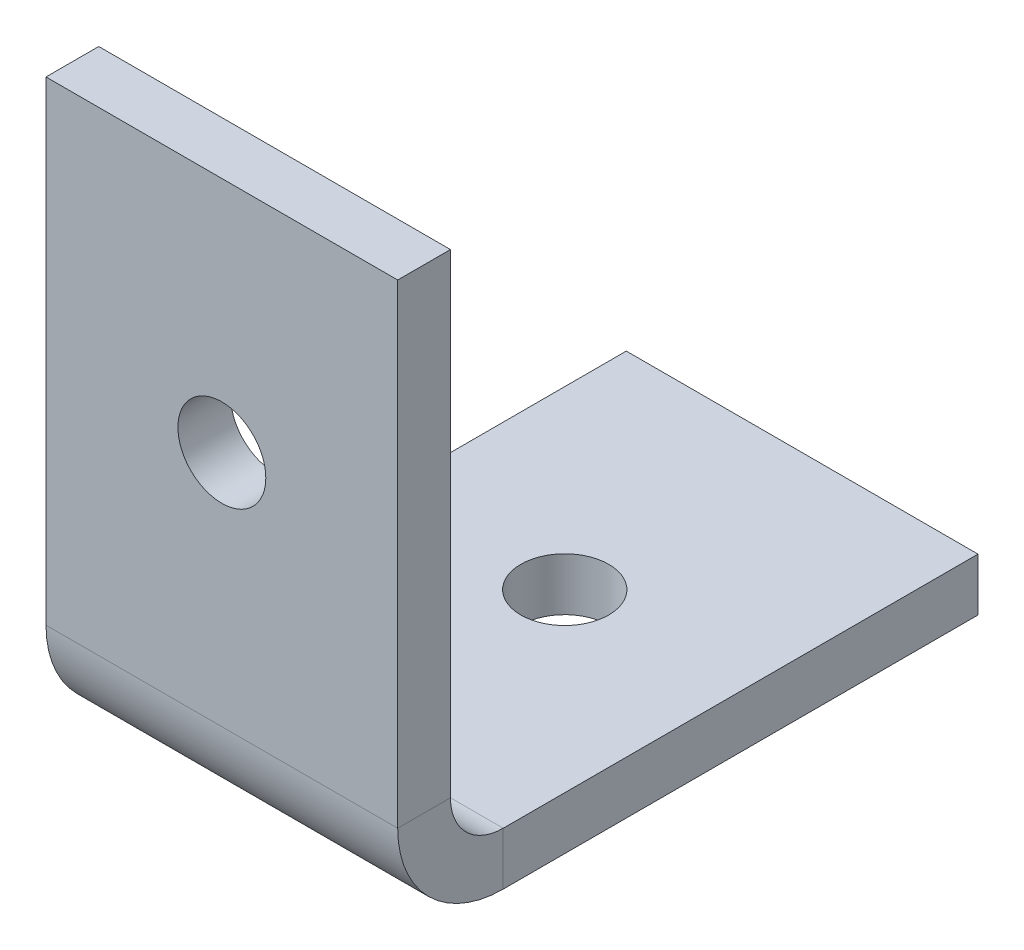
from build123d import *

# Parameters (mm, degrees)
BASE_FLANGE1_DEPTH = 20
CUT_EXTRUDE1_REACH = 50.877
SKETCH6_R          = 2.5
CUT_EXTRUDE2_REACH = 50.877
SKETCH7_R          = 2.5


# Sheet-metal steps are written as plain solids
with BuildPart() as part:
    # Sketch1 → Base-Flange1 (new body)
    with BuildSketch(Plane(origin=(0, 0, 0), x_dir=(0, 0, -1), z_dir=(1, 0, 0))):
        with BuildLine():
            Line((30, 0), (3, 0))
            ThreePointArc((3, 0), (0.878679656, 0.878679656), (0, 3))
            Line((0, 3), (0, 30))
            Line((0, 30), (-3, 30))
            Line((-3, 30), (-3, 3))
            ThreePointArc((-3, 3), (-1.242640687, -1.242640687), (3, -3))
            Line((3, -3), (30, -3))
            Line((30, -3), (30, 0))
        make_face()
    extrude(amount=BASE_FLANGE1_DEPTH)

    # Sketch6 → Cut-Extrude1 (cut, up to next)
    with BuildSketch(Plane.XZ.offset(3), mode=Mode.PRIVATE) as cut_extrude1_sk1:
        with Locations(Location((10, -16.5, 0), (0, 0, 270))):
            Circle(SKETCH6_R)
    cut_extrude1_tool1 = extrude(cut_extrude1_sk1.sketch, amount=-CUT_EXTRUDE1_REACH, mode=Mode.PRIVATE) & part.part
    add(cut_extrude1_tool1.solids().sort_by_distance((10, -3, -16.5))[0], mode=Mode.SUBTRACT)

    # Sketch7 → Cut-Extrude2 (cut, up to next)
    with BuildSketch(Plane.XY.offset(3), mode=Mode.PRIVATE) as cut_extrude2_sk1:
        with Locations((10, 16.5)):
            Circle(SKETCH7_R)
    cut_extrude2_tool1 = extrude(cut_extrude2_sk1.sketch, amount=-CUT_EXTRUDE2_REACH, mode=Mode.PRIVATE) & part.part
    add(cut_extrude2_tool1.solids().sort_by_distance((10, 16.5, 3))[0], mode=Mode.SUBTRACT)


solid = part.part
